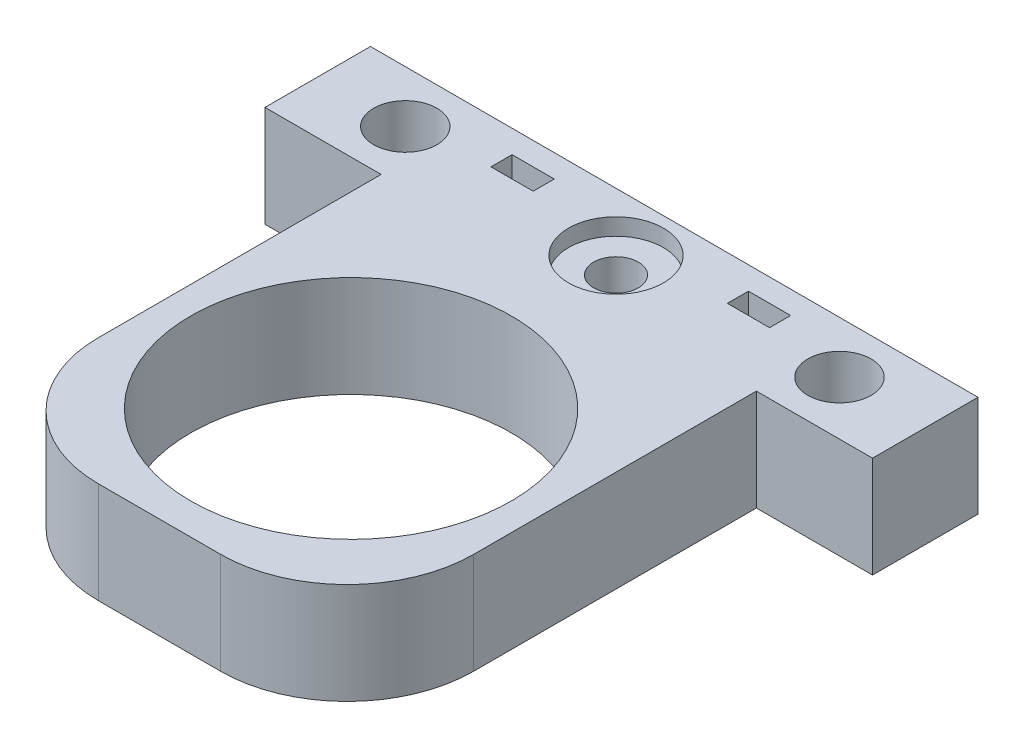
from build123d import *

# Parameters (mm, degrees)
BOSS_EXTRUDE1_DEPTH = 60
SKETCH2_R           = 7.5
CUT_EXTRUDE1_DEPTH  = 60
SKETCH3_R           = 5.25
CUT_EXTRUDE2_DEPTH  = 60
SKETCH4_R           = 11.5
CUT_EXTRUDE3_DEPTH  = 4
SKETCH5_W           = 10
SKETCH5_H           = 5
CUT_EXTRUDE4_DEPTH  = 60
SKETCH6_W           = 130
SKETCH6_H           = 90
BOSS_EXTRUDE2_DEPTH = 60
SKETCH8_W           = 130
SKETCH8_H           = 115
CUT_EXTRUDE6_DEPTH  = 20
SKETCH9_W           = 20.525641278
SKETCH9_H           = 90
CUT_EXTRUDE7_DEPTH  = 45
SKETCH7_R           = 38.5
CUT_EXTRUDE8_DEPTH  = 40
SKETCH12_W          = 88.948717444
SKETCH12_H          = 40
BOSS_EXTRUDE4_DEPTH = 7
SKETCH13_W          = 25
SKETCH13_H          = 40
BOSS_EXTRUDE5_DEPTH = 7
SKETCH14_W          = 25
SKETCH14_H          = 40
BOSS_EXTRUDE6_DEPTH = 7
SKETCH16_W          = 144.296296296
SKETCH16_H          = 122.248772368
CUT_EXTRUDE9_DEPTH  = 16
SKETCH23_R          = 10.574878896
BOSS_EXTRUDE7_DEPTH = 24
SKETCH24_R          = 5.3
CUT_EXTRUDE11_DEPTH = 24
SKETCH25_R          = 11.25
CUT_EXTRUDE12_DEPTH = 4
SKETCH26_R          = 41.241524366
BOSS_EXTRUDE8_DEPTH = 24
SKETCH27_R          = 38
CUT_EXTRUDE13_DEPTH = 24
FILLET2_R           = 30


with BuildPart() as part:
    # Sketch1 → Boss-Extrude1 (new body)
    with BuildSketch(Plane(origin=(0, 0, 0), x_dir=(1, 0, 0), z_dir=(0, 1, 0))):
        with BuildLine():
            Line((-65, 25), (65, 25))
            Line((65, 25), (65, -25))
            Line((65, -25), (32.897568299, -25))
            ThreePointArc((32.897568299, -25), (0, -6.5), (-32.897568299, -25))
            Line((-32.897568299, -25), (-65, -25))
            Line((-65, -25), (-65, 25))
        make_face()
    extrude(amount=BOSS_EXTRUDE1_DEPTH)

    # Sketch2 → Cut-Extrude1 (cut)
    with BuildSketch(Plane(origin=(0, 60, 0), x_dir=(1, 0, 0), z_dir=(0, 1, 0))):
        with Locations((-51.452605548, 12.714222387)):
            Circle(SKETCH2_R)
        with Locations((51.452605548, 12.714222387)):
            Circle(SKETCH2_R)
    extrude(amount=-CUT_EXTRUDE1_DEPTH, mode=Mode.SUBTRACT)

    # Sketch3 → Cut-Extrude2 (cut)
    with BuildSketch(Plane(origin=(0, 60, 0), x_dir=(1, 0, 0), z_dir=(0, 1, 0))):
        with Locations((0, 12.714222387)):
            Circle(SKETCH3_R)
    extrude(amount=-CUT_EXTRUDE2_DEPTH, mode=Mode.SUBTRACT)

    # Sketch4 → Cut-Extrude3 (cut)
    with BuildSketch(Plane(origin=(0, 60, 0), x_dir=(1, 0, 0), z_dir=(0, 1, 0))):
        with Locations((0, 12.714222387)):
            Circle(SKETCH4_R)
    extrude(amount=-CUT_EXTRUDE3_DEPTH, mode=Mode.SUBTRACT)

    # Sketch5 → Cut-Extrude4 (cut)
    with BuildSketch(Plane(origin=(0, 60, 0), x_dir=(1, 0, 0), z_dir=(0, 1, 0))):
        with Locations((-52.884181241, -16.580341224)):
            Rectangle(SKETCH5_W, SKETCH5_H)
        with Locations((-28.013085243, 17.079406564)):
            Rectangle(SKETCH5_W, SKETCH5_H)
        with Locations((52.884181241, -16.580341224)):
            Rectangle(SKETCH5_W, SKETCH5_H)
        with Locations((28.013085243, 17.079406564)):
            Rectangle(SKETCH5_W, SKETCH5_H)
    extrude(amount=-CUT_EXTRUDE4_DEPTH, mode=Mode.SUBTRACT)

    # Sketch6 → Boss-Extrude2 (add)
    with BuildSketch(Plane(origin=(0, 60, 0), x_dir=(1, 0, 0), z_dir=(0, 1, 0))):
        with Locations((0, -45)):
            Rectangle(SKETCH6_W, SKETCH6_H)
    extrude(amount=-BOSS_EXTRUDE2_DEPTH)

    # Sketch8 → Cut-Extrude6 (cut)
    with BuildSketch(Plane.XZ):
        with Locations((0, 32.5)):
            Rectangle(SKETCH8_W, SKETCH8_H)
    extrude(amount=-CUT_EXTRUDE6_DEPTH, mode=Mode.SUBTRACT)

    # Sketch9 → Cut-Extrude7 (cut)
    with BuildSketch(Plane(origin=(0, 60, 0), x_dir=(1, 0, 0), z_dir=(0, 1, 0))):
        with Locations((-54.737179361, -45)):
            Rectangle(SKETCH9_W, SKETCH9_H)
        with Locations((54.737179361, -45)):
            Rectangle(SKETCH9_W, SKETCH9_H)
    extrude(amount=-CUT_EXTRUDE7_DEPTH, mode=Mode.SUBTRACT)

    # Sketch7 → Cut-Extrude8 (cut)
    with BuildSketch(Plane(origin=(0, 60, 0), x_dir=(1, 0, 0), z_dir=(0, 1, 0))):
        with Locations((0, -51.285777613)):
            Circle(SKETCH7_R)
    extrude(amount=-CUT_EXTRUDE8_DEPTH, mode=Mode.SUBTRACT)

    # Sketch12 → Boss-Extrude4 (add)
    with BuildSketch(Plane.XY.offset(90)):
        with Locations((0, 40)):
            Rectangle(SKETCH12_W, SKETCH12_H)
    extrude(amount=BOSS_EXTRUDE4_DEPTH)

    # Sketch13 → Boss-Extrude5 (add)
    with BuildSketch(Plane(origin=(65, 0, 0), x_dir=(0, 0, -1), z_dir=(1, 0, 0))):
        with Locations((12.5, 40)):
            Rectangle(SKETCH13_W, SKETCH13_H)
    extrude(amount=BOSS_EXTRUDE5_DEPTH)

    # Sketch14 → Boss-Extrude6 (add)
    with BuildSketch(Plane.ZY.offset(65)):
        with Locations((-12.5, 40)):
            Rectangle(SKETCH14_W, SKETCH14_H)
    extrude(amount=BOSS_EXTRUDE6_DEPTH)

    # Sketch16 → Cut-Extrude9 (cut)
    with BuildSketch(Plane(origin=(0, 60, 0), x_dir=(1, 0, 0), z_dir=(0, 1, 0))):
        with Locations((0.148148148, -36.124386184)):
            Rectangle(SKETCH16_W, SKETCH16_H)
    extrude(amount=-CUT_EXTRUDE9_DEPTH, mode=Mode.SUBTRACT)

    # Sketch23 → Boss-Extrude7 (add)
    with BuildSketch(Plane(origin=(0, 44, 0), x_dir=(1, 0, 0), z_dir=(0, 1, 0))):
        with Locations((0, 12.714222387)):
            Circle(SKETCH23_R)
    extrude(amount=-BOSS_EXTRUDE7_DEPTH)

    # Sketch24 → Cut-Extrude11 (cut)
    with BuildSketch(Plane(origin=(0, 44, 0), x_dir=(1, 0, 0), z_dir=(0, 1, 0))):
        with Locations((0, 11.2)):
            Circle(SKETCH24_R)
    extrude(amount=-CUT_EXTRUDE11_DEPTH, mode=Mode.SUBTRACT)

    # Sketch25 → Cut-Extrude12 (cut)
    with BuildSketch(Plane(origin=(0, 44, 0), x_dir=(1, 0, 0), z_dir=(0, 1, 0))):
        with Locations((0, 11.2)):
            Circle(SKETCH25_R)
    extrude(amount=-CUT_EXTRUDE12_DEPTH, mode=Mode.SUBTRACT)

    # Sketch26 → Boss-Extrude8 (add)
    with BuildSketch(Plane(origin=(0, 44, 0), x_dir=(1, 0, 0), z_dir=(0, 1, 0))):
        with Locations((0, -51.285777613)):
            Circle(SKETCH26_R)
    extrude(amount=-BOSS_EXTRUDE8_DEPTH)

    # Sketch27 → Cut-Extrude13 (cut)
    with BuildSketch(Plane(origin=(0, 44, 0), x_dir=(1, 0, 0), z_dir=(0, 1, 0))):
        with Locations((0, -51.59650437)):
            Circle(SKETCH27_R)
    extrude(amount=-CUT_EXTRUDE13_DEPTH, mode=Mode.SUBTRACT)

    # Fillet2
    fillet2_edges = [part.edges().sort_by_distance(p)[0] for p in [
        (-44.474358722, 32, 97),
        (44.474358722, 32, 97),
    ]]
    fillet(fillet2_edges, radius=FILLET2_R)


solid = part.part
